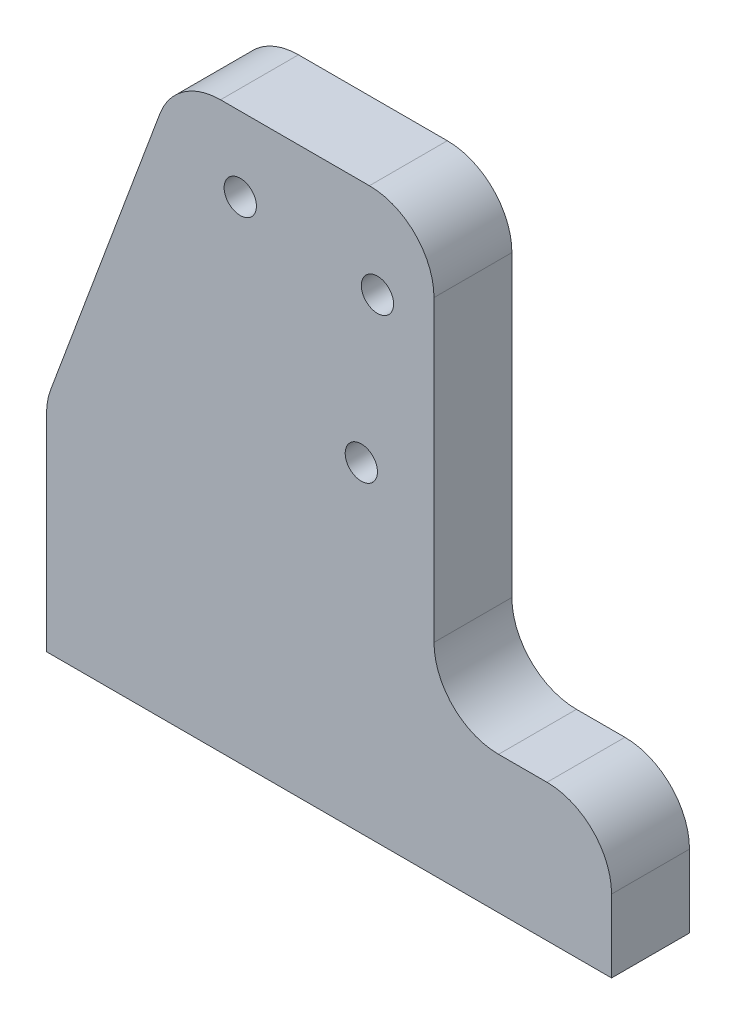
from build123d import *

# Parameters (mm, degrees)
BOSS_EXTRUDE1_DEPTH       = 4.826
M3X0_5_TAPPED_HOLE2_D     = 2
M3X0_5_TAPPED_HOLE3_D     = 2.5
M3X0_5_TAPPED_HOLE3_DEPTH = 5
M3X0_5_TAPPED_HOLE3_TIP   = 0.751075774
FILLET2_R                 = 4
CUT_EXTRUDE1_DEPTH        = 10
SKETCH23_R                = 1
CUT_EXTRUDE2_DEPTH        = 50.732185514


with BuildPart() as part:
    # Sketch1 → Boss-Extrude1 (new body)
    with BuildSketch(Plane.XY):
        Polygon((0, 13.5), (0, 0), (35, 0), (35, 8.5), (24, 8.5), (24, 35), (8, 35), align=None)
    extrude(amount=BOSS_EXTRUDE1_DEPTH)

    # M3x0.5 Tapped Hole2 (through all)
    with Locations(Plane.XY.offset(4.826)):
        with Locations((12, 30.4)):
            Hole(M3X0_5_TAPPED_HOLE2_D / 2)

    # M3x0.5 Tapped Hole3
    with Locations(Plane(origin=(0, 0, 0), x_dir=(-1, 0, 0), z_dir=(0, -1, 0))):
        with Locations((-16.73, -2.413), (-28.73, -2.413)):
            Hole(M3X0_5_TAPPED_HOLE3_D / 2, depth=M3X0_5_TAPPED_HOLE3_DEPTH)
            with Locations((0, 0, -(M3X0_5_TAPPED_HOLE3_DEPTH + M3X0_5_TAPPED_HOLE3_TIP / 2))):  # 118° drill point
                Cone(0, M3X0_5_TAPPED_HOLE3_D / 2, M3X0_5_TAPPED_HOLE3_TIP, mode=Mode.SUBTRACT)

    # Fillet2
    fillet2_edges = [part.edges().sort_by_distance(p)[0] for p in [
        (35, 8.5, 2.413),
        (24, 8.5, 2.413),
        (24, 35, 2.413),
        (0, 13.5, 2.413),
        (8, 35, 2.413),
    ]]
    fillet(fillet2_edges, radius=FILLET2_R)

    # Sketch19 → Cut-Extrude1 (cut)
    with BuildSketch(Plane.XY.offset(4.826)):
        with BuildLine():
            ThreePointArc((18.5, 19.9), (19.5, 18.9), (20.5, 19.9))
            ThreePointArc((20.5, 19.9), (19.5, 20.9), (18.5, 19.9))
        make_face()
    extrude(amount=-CUT_EXTRUDE1_DEPTH, mode=Mode.SUBTRACT)

    # Sketch23 → Cut-Extrude2 (cut, through all)
    with BuildSketch(Plane.XY.offset(4.826)):
        with Locations((20.5, 29.4)):
            Circle(SKETCH23_R)
    extrude(amount=-CUT_EXTRUDE2_DEPTH, mode=Mode.SUBTRACT)


solid = part.part
